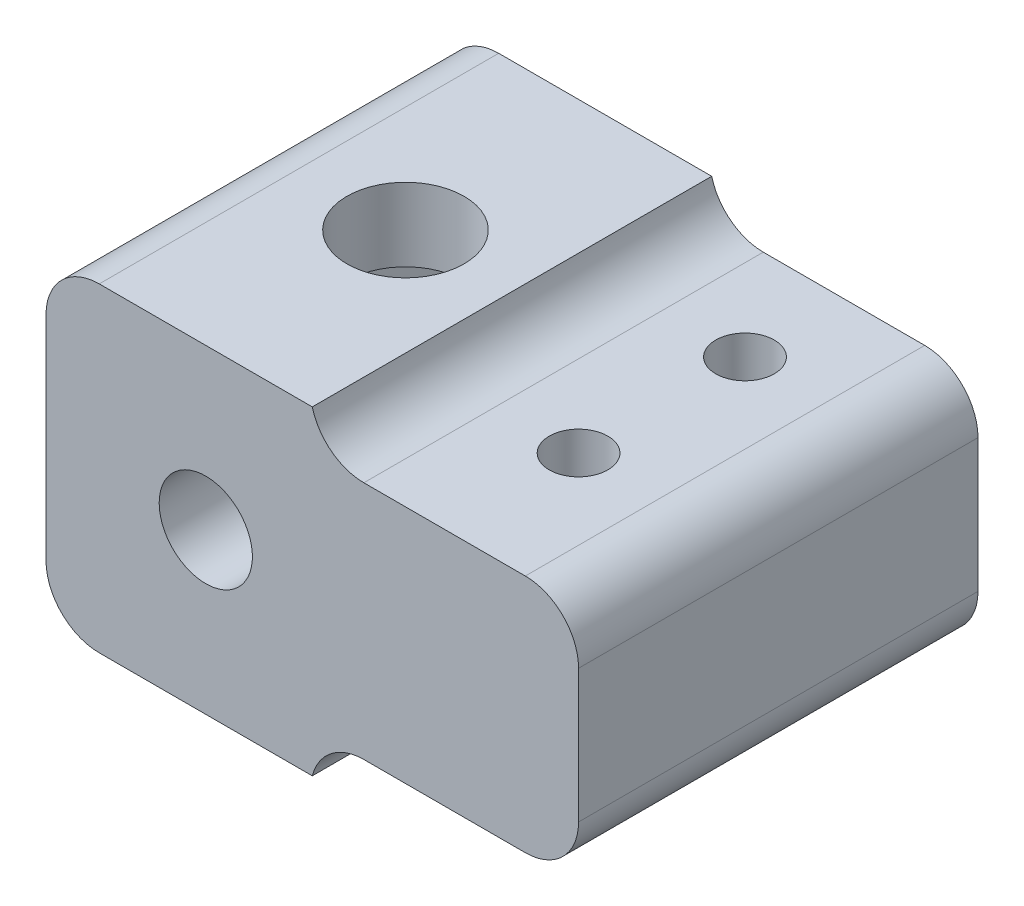
from build123d import *

# Parameters (mm, degrees)
SKETCH1_R               = 4.5
SKETCH1_R_2             = 1.25
BOSS_EXTRUDE1_DEPTH     = 8
SKETCH2_R               = 1.75
SKETCH2_R_2             = 1.25
CUT_EXTRUDE1_DEPTH      = 4
SKETCH4_W               = 12
SKETCH4_H               = 12
SKETCH4_W_2             = 6.5
SKETCH4_H_2             = 6.5
BOSS_EXTRUDE2_DEPTH     = 15
SKETCH5_W               = 15
SKETCH5_H               = 12
BOSS_EXTRUDE3_DEPTH     = 8
CUT_EXTRUDE2_DEPTH      = 24.769728648
CUT_EXTRUDE2_DEPTH_BACK = 24.769728648
SKETCH6_R               = 1.1
FILLET1_R               = 2
CUT_EXTRUDE3_START      = -1.5
SKETCH7_W               = 10
SKETCH7_H               = 15
SKETCH7_R               = 1.1
CUT_EXTRUDE3_DEPTH      = 1.5
CUT_EXTRUDE4_START      = -12
SKETCH7_2_W             = 10
SKETCH7_2_H             = 15
SKETCH7_2_R             = 1.1
CUT_EXTRUDE4_DEPTH      = 1.5
FILLET2_R               = 2
SKETCH1_2_R             = 4.5
SKETCH1_2_R_2           = 1.25
CUT_EXTRUDE5_DEPTH      = 8
BOSS_EXTRUDE5_OUTLINE_W = 6.5
BOSS_EXTRUDE5_OUTLINE_H = 6.5
BOSS_EXTRUDE5_OUTLINE_R = 1.75
BOSS_EXTRUDE5_DEPTH     = 3
SKETCH8_R               = 2.2
CUT_EXTRUDE6_DEPTH      = 14


with BuildPart() as part:
    # Sketch1 → Boss-Extrude1 (new body)
    with BuildSketch(Plane.XY):
        Circle(SKETCH1_R)
        Circle(SKETCH1_R_2, mode=Mode.SUBTRACT)
    extrude(amount=BOSS_EXTRUDE1_DEPTH)

    # Sketch2 → Cut-Extrude1 (cut)
    with BuildSketch(Plane(origin=(0, 0, 0), x_dir=(-1, 0, 0), z_dir=(0, 0, -1))):
        Circle(SKETCH2_R)
        Circle(SKETCH2_R_2, mode=Mode.SUBTRACT)
    extrude(amount=-CUT_EXTRUDE1_DEPTH, mode=Mode.SUBTRACT)

    # Sketch4 → Boss-Extrude2 (add)
    with BuildSketch(Plane(origin=(0, 0, 0), x_dir=(-1, 0, 0), z_dir=(0, 0, -1))):
        Rectangle(SKETCH4_W, SKETCH4_H)
        Rectangle(SKETCH4_W_2, SKETCH4_H_2, mode=Mode.SUBTRACT)
    extrude(amount=BOSS_EXTRUDE2_DEPTH)

    # Sketch5 → Boss-Extrude3 (add)
    with BuildSketch(Plane(origin=(6, 0, 0), x_dir=(0, 0, -1), z_dir=(1, 0, 0))):
        with Locations((7.5, 0)):
            Rectangle(SKETCH5_W, SKETCH5_H)
    extrude(amount=BOSS_EXTRUDE3_DEPTH)

    # Sketch6 → Cut-Extrude2 (cut, two sides: drawn at the far end of the back side and taken through both)
    with BuildSketch(Plane(origin=(0, 6, 0), x_dir=(1, 0, 0), z_dir=(0, 1, 0)).offset(-CUT_EXTRUDE2_DEPTH_BACK)):
        with Locations(Location((9, 11.25, 0), (0, 0, 270))):
            Circle(SKETCH6_R)
        with Locations(Location((9, 5, 0), (0, 0, 270))):
            Circle(SKETCH6_R)
    extrude(amount=CUT_EXTRUDE2_DEPTH + CUT_EXTRUDE2_DEPTH_BACK, mode=Mode.SUBTRACT)

    # Fillet1
    fillet1_edges = [part.edges().sort_by_distance(p)[0] for p in [
        (-6, -6, -7.5),
        (-6, 6, -7.5),
    ]]
    fillet(fillet1_edges, radius=FILLET1_R)

    # Sketch7 → Cut-Extrude3 (cut)
    with BuildSketch(Plane.XZ.offset(6).offset(CUT_EXTRUDE3_START)):
        with Locations((9, -7.5)):
            Rectangle(SKETCH7_W, SKETCH7_H)
        with Locations(Location((9, -5, 0), (0, 0, 270))):
            Circle(SKETCH7_R, mode=Mode.SUBTRACT)
    extrude(amount=CUT_EXTRUDE3_DEPTH, mode=Mode.SUBTRACT)

    # Sketch7<2> → Cut-Extrude4 (cut)
    with BuildSketch(Plane.XZ.offset(6).offset(CUT_EXTRUDE4_START)):
        with Locations((9, -7.5)):
            Rectangle(SKETCH7_2_W, SKETCH7_2_H)
        with Locations(Location((9, -5, 0), (0, 0, 270))):
            Circle(SKETCH7_2_R, mode=Mode.SUBTRACT)
    extrude(amount=CUT_EXTRUDE4_DEPTH, mode=Mode.SUBTRACT)

    # Fillet2
    # the kernel refuses this fillet: 2 mm, written as the material it adds along each edge
    with BuildSketch(Plane(origin=(4, 4.5, 0), x_dir=(1, 0, 0), z_dir=(0, 0, -1))) as fillet2_piece_1:
        with BuildLine():
            CenterArc((1.936491673, -2), FILLET2_R, 90, 75.522487814)
            Line((0, -1.5), (0, 0))
            Line((0, 0), (1.936491673, 0))
        make_face()
    extrude(amount=15)
    with BuildSketch(Plane(origin=(4, -4.5, 0), x_dir=(0, -1, 0), z_dir=(0, 0, -1))) as fillet2_piece_2:
        with BuildLine():
            CenterArc((2, -1.936491673), FILLET2_R, 104.477512186, 75.522487814)
            Line((0, -1.936491673), (0, 0))
            Line((0, 0), (1.5, 0))
        make_face()
    extrude(amount=15)
    # the kernel refuses this fillet: 2 mm, written as the material it takes off along each edge
    with BuildSketch(Plane(origin=(14, -4.5, -20), x_dir=(0, 1, 0), z_dir=(0, 0, 1)), Plane(origin=(14, 4.5, -20), x_dir=(-1, 0, 0), z_dir=(0, 0, 1))) as fillet2_2_piece_1:
        with BuildLine():
            CenterArc((FILLET2_R, FILLET2_R), FILLET2_R, 180, 90)
            Line((0, FILLET2_R), (0, 0))
            Line((0, 0), (FILLET2_R, 0))
        make_face()
    extrude(amount=25, mode=Mode.SUBTRACT)

    # Sketch1<2> → Cut-Extrude5 (cut)
    with BuildSketch(Plane.XY):
        Circle(SKETCH1_2_R)
        Circle(SKETCH1_2_R_2, mode=Mode.SUBTRACT)
    extrude(amount=CUT_EXTRUDE5_DEPTH, mode=Mode.SUBTRACT)

    # Boss-Extrude5: read off the stored shape, not the designer's step
    # Boss-Extrude5 outline → Boss-Extrude5 (add)
    with BuildSketch(Plane(origin=(0, 0, 0), x_dir=(-1, 0, 0), z_dir=(0, 0, -1))):
        Rectangle(BOSS_EXTRUDE5_OUTLINE_W, BOSS_EXTRUDE5_OUTLINE_H)
        Circle(BOSS_EXTRUDE5_OUTLINE_R, mode=Mode.SUBTRACT)
    extrude(amount=BOSS_EXTRUDE5_DEPTH)

    # Sketch8 → Cut-Extrude6 (cut)
    with BuildSketch(Plane.XZ.offset(6)):
        with Locations(Location((0, -7.5, 0), (0, 0, 270))):
            Circle(SKETCH8_R)
    extrude(amount=-CUT_EXTRUDE6_DEPTH, mode=Mode.SUBTRACT)


solid = part.part
